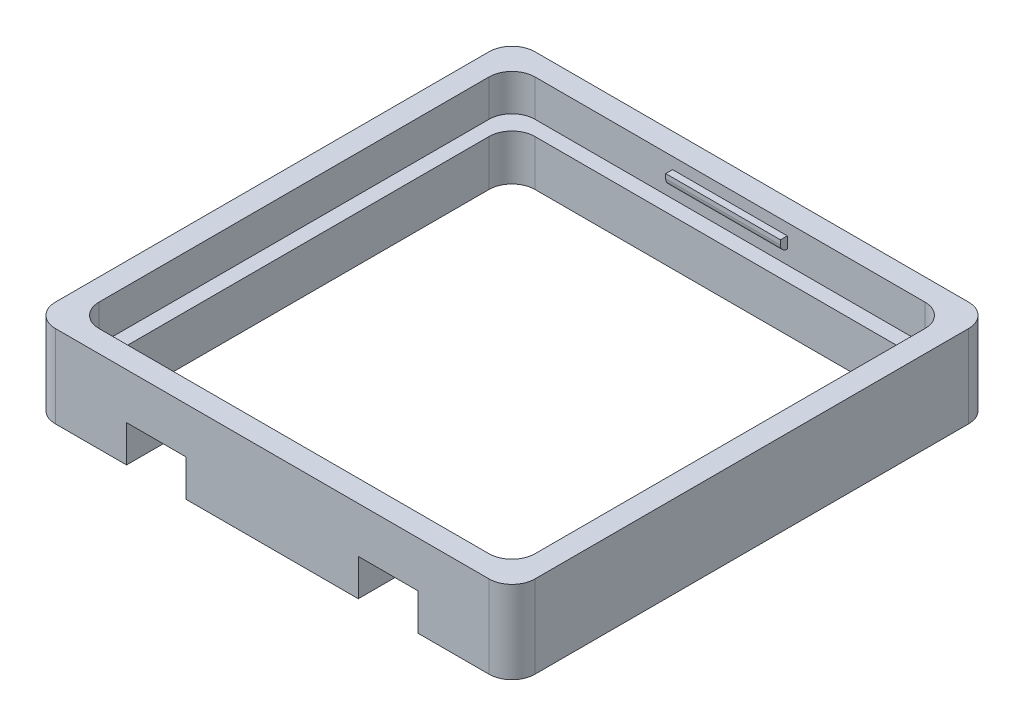
from build123d import *

# Parameters (mm, degrees)
BOSS_EXTRUDE2_DEPTH = 9.144
SKETCH2_W           = 6.604
SKETCH2_H           = 8.128
CUT_EXTRUDE1_DEPTH  = 49.022
CUT_EXTRUDE3_DEPTH  = 39.635145062
CUT_EXTRUDE4_DEPTH  = 4.064
SKETCH7_W           = 12.7
SKETCH7_H           = 1.27
BOSS_EXTRUDE3_DEPTH = 0.762
FILLET1_R           = 0.762


with BuildPart() as part:
    # Sketch1 → Boss-Extrude2 (new body)
    with BuildSketch(Plane(origin=(0, 0, 0), x_dir=(1, 0, 0), z_dir=(0, 1, 0))):
        with BuildLine():
            Line((-24.003, -26.543), (24.003, -26.543))
            ThreePointArc((24.003, -26.543), (25.799051224, -25.799051224), (26.543, -24.003))
            Line((26.543, -24.003), (26.543, 24.003))
            ThreePointArc((26.543, 24.003), (25.799051224, 25.799051224), (24.003, 26.543))
            Line((24.003, 26.543), (-24.003, 26.543))
            ThreePointArc((-24.003, 26.543), (-25.799051224, 25.799051224), (-26.543, 24.003))
            Line((-26.543, 24.003), (-26.543, -24.003))
            ThreePointArc((-26.543, -24.003), (-25.799051224, -25.799051224), (-24.003, -26.543))
        make_face()
    extrude(amount=BOSS_EXTRUDE2_DEPTH)

    # Sketch2 → Cut-Extrude1 (cut)
    with BuildSketch(Plane.XY.offset(26.543)):
        with Locations((12.827, 0)):
            Rectangle(SKETCH2_W, SKETCH2_H)
        with Locations((-12.827, 0)):
            Rectangle(SKETCH2_W, SKETCH2_H)
    extrude(amount=-CUT_EXTRUDE1_DEPTH, mode=Mode.SUBTRACT)

    # Sketch5 → Cut-Extrude3 (cut, through all)
    with BuildSketch(Plane(origin=(0, 9.144, 0), x_dir=(1, 0, 0), z_dir=(0, 1, 0))):
        with BuildLine():
            Line((-19.939, -22.479), (19.939, -22.479))
            ThreePointArc((19.939, -22.479), (21.735051224, -21.735051224), (22.479, -19.939))
            Line((22.479, -19.939), (22.479, 19.939))
            ThreePointArc((22.479, 19.939), (21.735051224, 21.735051224), (19.939, 22.479))
            Line((19.939, 22.479), (-19.939, 22.479))
            ThreePointArc((-19.939, 22.479), (-21.735051224, 21.735051224), (-22.479, 19.939))
            Line((-22.479, 19.939), (-22.479, -19.939))
            ThreePointArc((-22.479, -19.939), (-21.735051224, -21.735051224), (-19.939, -22.479))
        make_face()
    extrude(amount=-CUT_EXTRUDE3_DEPTH, mode=Mode.SUBTRACT)

    # Sketch6 → Cut-Extrude4 (cut)
    with BuildSketch(Plane(origin=(0, 9.144, 0), x_dir=(1, 0, 0), z_dir=(0, 1, 0))):
        with BuildLine():
            Line((-21.59, -24.13), (21.59, -24.13))
            ThreePointArc((21.59, -24.13), (23.386051224, -23.386051224), (24.13, -21.59))
            Line((24.13, -21.59), (24.13, 21.59))
            ThreePointArc((24.13, 21.59), (23.386051224, 23.386051224), (21.59, 24.13))
            Line((21.59, 24.13), (-21.59, 24.13))
            ThreePointArc((-21.59, 24.13), (-23.386051224, 23.386051224), (-24.13, 21.59))
            Line((-24.13, 21.59), (-24.13, -21.59))
            ThreePointArc((-24.13, -21.59), (-23.386051224, -23.386051224), (-21.59, -24.13))
        make_face()
    extrude(amount=-CUT_EXTRUDE4_DEPTH, mode=Mode.SUBTRACT)

    # Sketch7 → Boss-Extrude3 (add)
    with BuildSketch(Plane.XY.offset(-24.13)):
        with Locations((0, 7.239)):
            Rectangle(SKETCH7_W, SKETCH7_H)
    extrude(amount=BOSS_EXTRUDE3_DEPTH)

    # Fillet1
    fillet1_edges = [part.edges().sort_by_distance(p)[0] for p in [
        (0, 6.604, -23.368),
    ]]
    fillet(fillet1_edges, radius=FILLET1_R - 0.0001)  # a hair under: the kernel refuses the full size


solid = part.part
